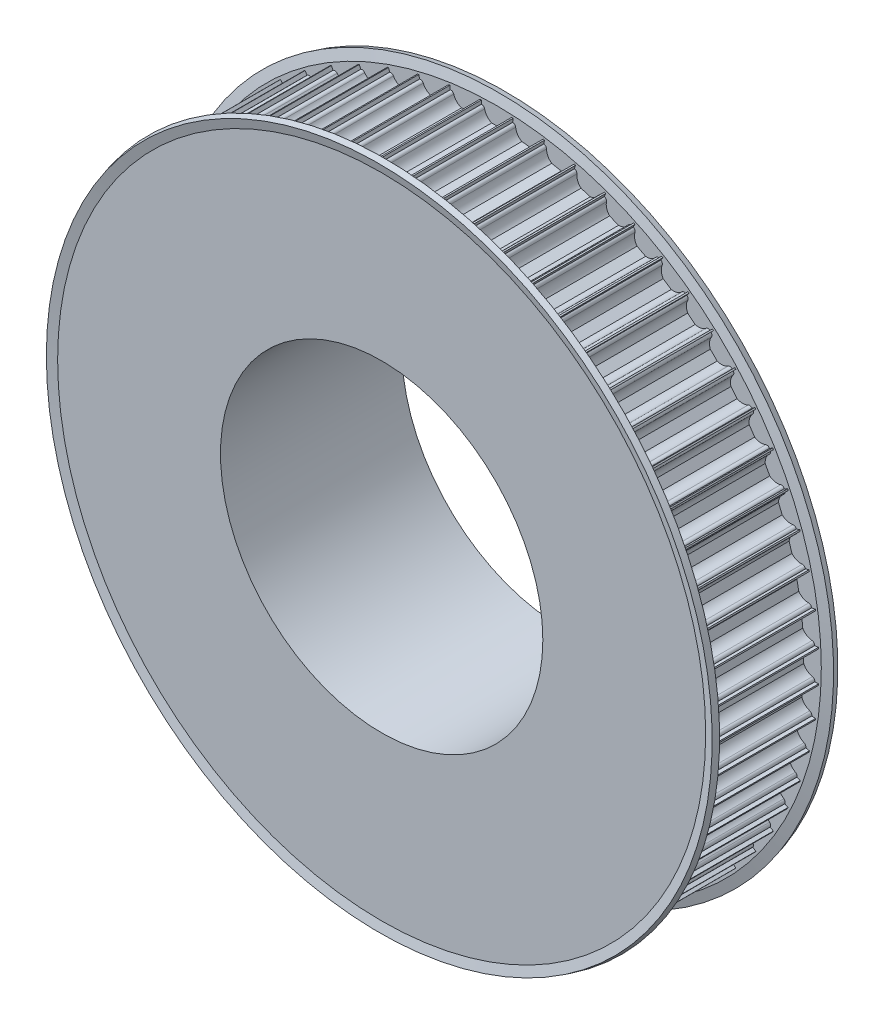
from build123d import *

# Parameters (mm, degrees)
CUT_EXTRUDE1_REACH = 123.758
CIRPATTERN1_COUNT  = 64


with BuildPart() as part:
    # Sketch1 → Revolve1 (revolve)
    with BuildSketch(Plane(origin=(0, 0, 0), x_dir=(0, 0, -1), z_dir=(1, 0, 0))):
        Polygon((-5, 40), (40, 40), (40, 55.5), (25, 55.5), (25, 80), (-5, 80), align=None)
    revolve(axis=Axis((0, 0, 0), (0, 0, -1)))

    # Sketch2 → Cut-Extrude1 (cut, up to next)
    with BuildSketch(Plane.XY.offset(5), mode=Mode.PRIVATE) as cut_extrude1_sk1:
        with BuildLine():
            Line((-3.674234614, 79), (-3.75, 79))
            Line((-3.75, 79), (-3.75, 81))
            Line((-3.75, 81), (3.75, 81))
            Line((3.75, 81), (3.75, 79))
            Line((3.75, 79), (3.674234614, 79))
            ThreePointArc((3.674234614, 79), (3.199892965, 78.830947502), (2.939387691, 78.4))
            ThreePointArc((2.939387691, 78.4), (2.331759211, 77.112435701), (1.198957881, 76.25))
            Line((1.198957881, 76.25), (-1.198957881, 76.25))
            ThreePointArc((-1.198957881, 76.25), (-2.331759211, 77.112435701), (-2.939387691, 78.4))
            ThreePointArc((-2.939387691, 78.4), (-3.199892965, 78.830947502), (-3.674234614, 79))
        make_face()
    cut_extrude1_tool1 = extrude(cut_extrude1_sk1.sketch, amount=-CUT_EXTRUDE1_REACH, mode=Mode.PRIVATE) & part.part
    cut_extrude1 = cut_extrude1_tool1.solids().sort_by_distance((0, 78.935169, 5))[0]
    add(cut_extrude1, mode=Mode.SUBTRACT)

    # CirPattern1: Cut-Extrude1 ×64 about axis
    cirpattern1_axis = Axis((0, 0, 5), (0, 0, 1))
    for i in range(1, CIRPATTERN1_COUNT):
        add(cut_extrude1.rotate(cirpattern1_axis, i * 360 / CIRPATTERN1_COUNT), mode=Mode.SUBTRACT)

    # Sketch3 → Revolve2 (revolve)
    with BuildSketch(Plane(origin=(0, 0, 0), x_dir=(0, 0, -1), z_dir=(1, 0, 0))):
        Polygon((25, 55.5), (25, 80.412521254), (25.591966801, 82.621771432), (24.143078062, 83.01), (23.5, 80.61), (23.5, 55.5), align=None)
        Polygon((-4.143078062, 83.01), (-3.5, 80.61), (-3.5, 55.5), (-5, 55.5), (-5, 80.412521254), (-5.591966801, 82.621771432), align=None)
    revolve(axis=Axis((0, 0, 0), (0, 0, 1)))


solid = part.part
